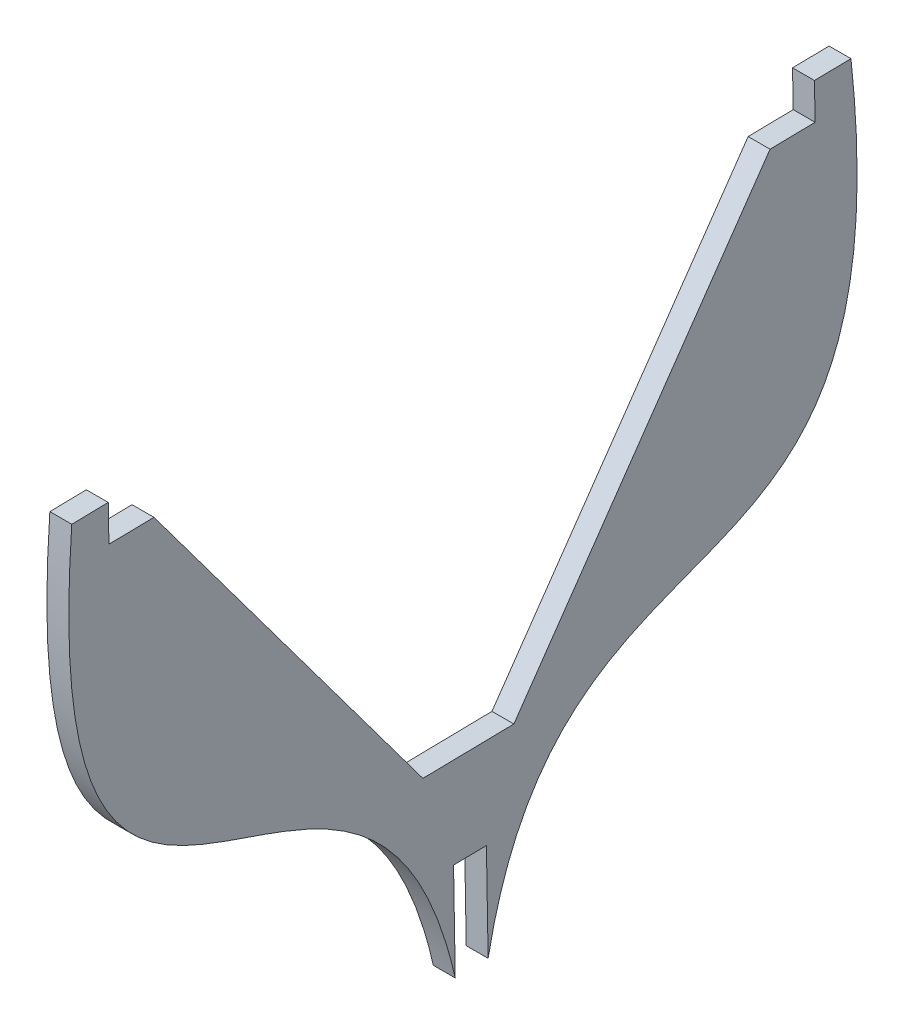
from build123d import *

# Parameters (mm, degrees)
BOSS_EXTRU_3_DEPTH      = 6
ENL_V_MAT_EXTRU_1_DEPTH = 6


with BuildPart() as part:
    # Esquisse2 → Boss.-Extru.3 (new body)
    with BuildSketch(Plane(origin=(0, 0, 0), x_dir=(0, 0, -1), z_dir=(1, 0, 0))):
        with BuildLine():
            Line((-113.249842848, 373.743275477), (-103.249842848, 373.917892938))
            Line((-103.249842848, 373.917892938), (-103.075225387, 363.917892938))
            Line((-103.075225387, 363.917892938), (-90.738016194, 364.133322151))
            Line((-90.738016194, 364.133322151), (-17.092406184, 265.404058623))
            Line((-17.092406184, 265.404058623), (7.81597477, 265.839002445))
            Line((7.81597477, 265.839002445), (77.969767883, 367.079254631))
            Line((77.969767883, 367.079254631), (90.306977076, 367.294683844))
            Line((90.306977076, 367.294683844), (90.132359616, 377.294683844))
            Line((90.132359616, 377.294683844), (100.132359616, 377.469301305))
            add(Edge.make_bspline(
                [(100.132359616, 377.469301305), (117.54675332, 215.268573461), (-5.995968613, 343.377380575), (-2.833663803, 162.278376859)],
                knots=[0, 0, 0, 0, 1, 1, 1, 1], degree=3))
            add(Edge.make_bspline(
                [(-113.249842848, 373.743275477), (-124.990730908, 211.033445508), (-5.995968613, 343.377380575), (-2.833663803, 162.278376859)],
                knots=[0, 0, 0, 0, 1, 1, 1, 1], degree=3))
        make_face()
    extrude(amount=BOSS_EXTRU_3_DEPTH)

    # Esquisse3 → Enlèv. mat.-Extru.1 (cut)
    with BuildSketch(Plane(origin=(6, 0, 0), x_dir=(0, 0, -1), z_dir=(1, 0, 0))):
        Polygon((-8.231649436, 213.625677678), (-8.703116579, 240.625677678), (0.296883421, 240.782833392), (0.768350564, 213.782833392), (66.545438014, 120.763695448), (-67.950672873, 133.097214493), align=None)
    extrude(amount=-ENL_V_MAT_EXTRU_1_DEPTH, mode=Mode.SUBTRACT)


solid = part.part
